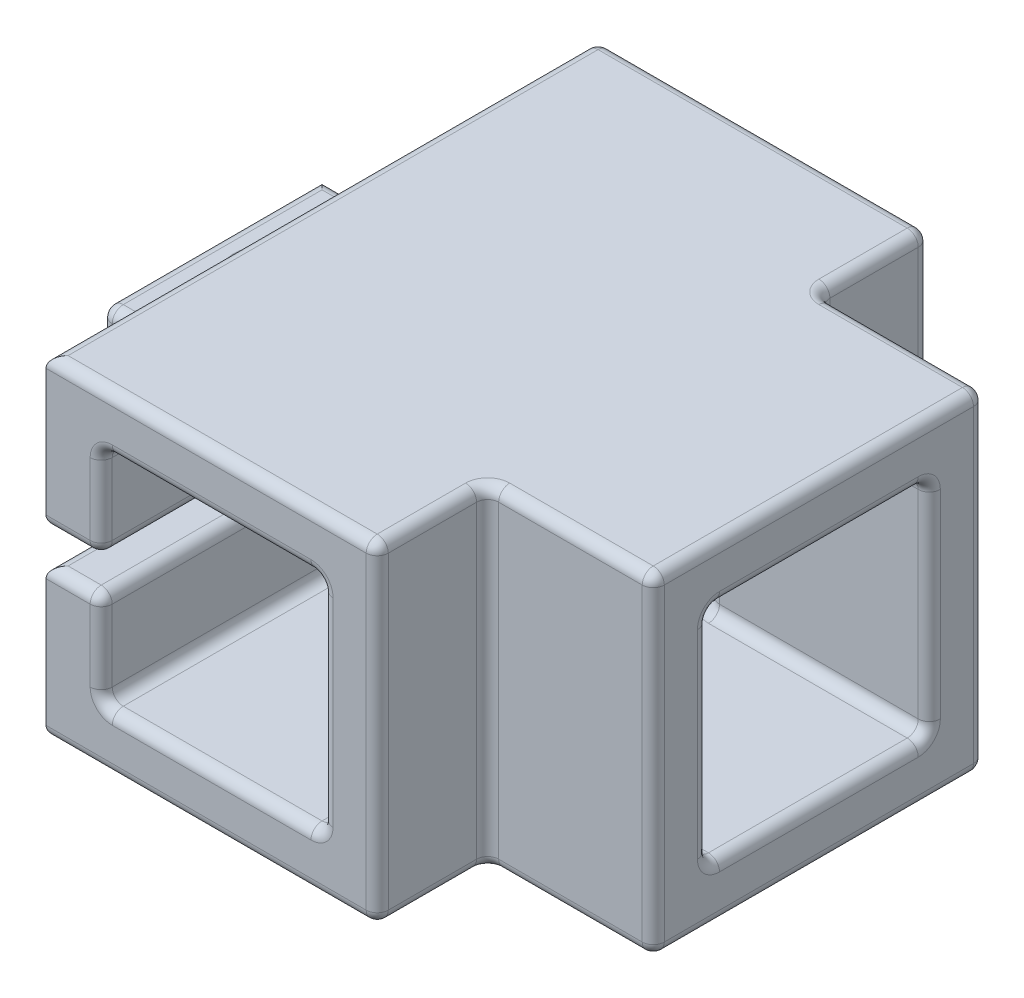
from build123d import *

# Parameters (mm, degrees)
SKETCH1_W           = 30
SKETCH1_H           = 30
SKETCH1_W_2         = 20
SKETCH1_H_2         = 20
BOSS_EXTRUDE1_DEPTH = 50
BOSS_EXTRUDE2_DEPTH = 30
SKETCH3_W           = 20
SKETCH3_H           = 20
CUT_EXTRUDE1_DEPTH  = 6
BOSS_EXTRUDE3_START = -15
SKETCH4_W           = 10
SKETCH4_H           = 5
BOSS_EXTRUDE3_DEPTH = 20
CUT_EXTRUDE2_DEPTH  = 30
SKETCH6_W           = 5
SKETCH6_H           = 3
CUT_EXTRUDE3_DEPTH  = 140
SKETCH7_W           = 30
SKETCH7_H           = 30
CUT_EXTRUDE4_DEPTH  = 15
FILLET1_R           = 1
FILLET2_R           = 1
FILLET3_R           = 1
FILLET4_R           = 1


with BuildPart() as part:
    # Sketch1 → Boss-Extrude1 (new body)
    with BuildSketch(Plane.XY):
        with Locations((4.157585004, -1.897870029)):
            Rectangle(SKETCH1_W, SKETCH1_H)
        with Locations((4.157585004, -1.897870029)):
            Rectangle(SKETCH1_W_2, SKETCH1_H_2, mode=Mode.SUBTRACT)
    extrude(amount=BOSS_EXTRUDE1_DEPTH)

    # Sketch2 → Boss-Extrude2 (add)
    with BuildSketch(Plane(origin=(19.157585004, 0, 0), x_dir=(0, 0, -1), z_dir=(1, 0, 0))):
        Polygon((-25, 13.102129971), (-10, 13.102129971), (-10, -16.897870029), (-40, -16.897870029), (-40, 13.102129971), align=None)
        Polygon((-35, 8.102129971), (-25, 8.102129971), (-15, 8.102129971), (-15, -11.897870029), (-35, -11.897870029), align=None, mode=Mode.SUBTRACT)
    extrude(amount=BOSS_EXTRUDE2_DEPTH)

    # Sketch3 → Cut-Extrude1 (cut)
    with BuildSketch(Plane(origin=(19.157585004, 0, 0), x_dir=(0, 0, -1), z_dir=(1, 0, 0))):
        with Locations((-25, -1.897870029)):
            Rectangle(SKETCH3_W, SKETCH3_H)
    extrude(amount=-CUT_EXTRUDE1_DEPTH, mode=Mode.SUBTRACT)

    # Sketch4 → Boss-Extrude3 (add)
    with BuildSketch(Plane(origin=(0, 0, 0), x_dir=(-1, 0, 0), z_dir=(0, 0, -1)).offset(BOSS_EXTRUDE3_START)):
        with Locations((15.842414996, 2.102129971)):
            Rectangle(SKETCH4_W, SKETCH4_H)
        with Locations((15.842414996, -5.897870029)):
            Rectangle(SKETCH4_W, SKETCH4_H)
    extrude(amount=-BOSS_EXTRUDE3_DEPTH)

    # Sketch5 → Cut-Extrude2 (cut)
    with BuildSketch(Plane(origin=(0, 4.602129971, 0), x_dir=(1, 0, 0), z_dir=(0, 1, 0))):
        with BuildLine():
            ThreePointArc((-13.842414996, -25), (-14.790952771, -23.298698383), (-16.736842187, -23.211145618))
            Line((-16.736842187, -23.211145618), (-14.947987805, -26.788854382))
            ThreePointArc((-14.947987805, -26.788854382), (-14.141113379, -26.051462224), (-13.842414996, -25))
        make_face()
        with BuildLine():
            Line((-14.947987805, -26.788854382), (-16.736842187, -23.211145618))
            ThreePointArc((-16.736842187, -23.211145618), (-17.631269378, -25.894427191), (-14.947987805, -26.788854382))
        make_face()
    extrude(amount=-CUT_EXTRUDE2_DEPTH, mode=Mode.SUBTRACT)

    # Sketch6 → Cut-Extrude3 (cut)
    with BuildSketch(Plane.XY.offset(50)):
        with Locations((-8.342414996, -1.897870029)):
            Rectangle(SKETCH6_W, SKETCH6_H)
    extrude(amount=-CUT_EXTRUDE3_DEPTH, mode=Mode.SUBTRACT)

    # Sketch7 → Cut-Extrude4 (cut)
    with BuildSketch(Plane(origin=(49.157585004, 0, 0), x_dir=(0, 0, -1), z_dir=(1, 0, 0))):
        with Locations((-25, -1.897870029)):
            Rectangle(SKETCH7_W, SKETCH7_H)
    extrude(amount=-CUT_EXTRUDE4_DEPTH, mode=Mode.SUBTRACT)

    # Fillet1
    fillet1_edges = [part.edges().sort_by_distance(p)[0] for p in [
        (-5.842414996, -7.647870029, 0),
        (-5.842414996, -7.647870029, 50),
        (-5.842414996, -3.397870029, 25),
        (-5.842414996, -0.397870029, 25),
        (-10.842414996, -10.147870029, 0),
        (-8.342414996, -0.397870029, 0),
        (-8.342414996, -3.397870029, 0),
        (19.157585004, -1.897870029, 50),
        (24.157585004, 8.102129971, 15),
        (24.157585004, -11.897870029, 15),
        (34.157585004, -1.897870029, 15),
        (24.157585004, -11.897870029, 35),
        (24.157585004, 8.102129971, 35),
        (26.657585004, 13.102129971, 10),
        (26.657585004, -16.897870029, 10),
        (26.657585004, -16.897870029, 40),
        (26.657585004, 13.102129971, 40),
        (34.157585004, -1.897870029, 35),
        (34.157585004, -1.897870029, 10),
        (34.157585004, -16.897870029, 25),
        (34.157585004, -1.897870029, 40),
        (34.157585004, 13.102129971, 25),
        (34.157585004, 8.102129971, 25),
        (34.157585004, -11.897870029, 25),
        (4.157585004, 8.102129971, 0),
        (14.157585004, 8.102129971, 42.5),
        (-5.842414996, 3.852129971, 0),
        (-5.842414996, 8.102129971, 25),
        (4.157585004, -11.897870029, 0),
        (-5.842414996, -11.897870029, 25),
        (14.157585004, -1.897870029, 0),
        (14.157585004, -11.897870029, 42.5),
        (4.157585004, 8.102129971, 50),
        (4.157585004, 13.102129971, 50),
        (-5.842414996, 3.852129971, 50),
        (4.157585004, -11.897870029, 50),
        (14.157585004, -1.897870029, 50),
        (19.157585004, 13.102129971, 5),
        (19.157585004, -16.897870029, 5),
        (19.157585004, -1.897870029, 40),
        (19.157585004, -1.897870029, 10),
        (4.157585004, 13.102129971, 0),
        (14.157585004, -11.897870029, 7.5),
        (19.157585004, -1.897870029, 0),
        (14.157585004, 8.102129971, 7.5),
        (14.157585004, -1.897870029, 15),
        (14.157585004, -1.897870029, 35),
        (4.157585004, -16.897870029, 0),
        (-10.842414996, 6.352129971, 0),
        (-10.842414996, 13.102129971, 25),
        (19.157585004, 13.102129971, 45),
        (19.157585004, -16.897870029, 45),
        (-10.842414996, -16.897870029, 25),
        (4.157585004, -16.897870029, 50),
    ]]
    fillet(fillet1_edges, radius=FILLET1_R)

    # Fillet2
    # the kernel refuses this fillet: 1 mm, written as the material it takes off along each edge
    with BuildSketch(Plane(origin=(-19.842414996, -7.397870029, 34), x_dir=(-1, 0, 0), z_dir=(0, 0, 1))) as fillet2_piece_1_section:
        Polygon((0, 0), (FILLET2_R, 0), (FILLET2_R, FILLET2_R), (0, FILLET2_R), align=None)
    fillet2_piece_1 = extrude(amount=FILLET2_R, mode=Mode.PRIVATE)
    fillet2_piece_1 = fillet2_piece_1 - Plane(origin=(-19.842414996, -7.397870029, 34), x_dir=(0.7071067811865475, 0.7071067811865476, 0), z_dir=(0, 0, 1)) * Sphere(FILLET2_R, mode=Mode.PRIVATE)
    add(fillet2_piece_1, mode=Mode.SUBTRACT)
    with BuildSketch(Plane(origin=(-19.842414996, -7.397870029, 16), x_dir=(0, 0, -1), z_dir=(-1, 0, 0))) as fillet2_piece_2_section:
        Polygon((0, 0), (FILLET2_R, 0), (FILLET2_R, FILLET2_R), (0, FILLET2_R), align=None)
    fillet2_piece_2 = extrude(amount=FILLET2_R, mode=Mode.PRIVATE)
    fillet2_piece_2 = fillet2_piece_2 - Plane(origin=(-19.842414996, -7.397870029, 16), x_dir=(0, 0.7071067811865475, 0.7071067811865475), z_dir=(-1, 0, 0)) * Sphere(FILLET2_R, mode=Mode.PRIVATE)
    add(fillet2_piece_2, mode=Mode.SUBTRACT)
    with BuildSketch(Plane(origin=(-20.842414996, -3.397870029, 12.5), x_dir=(1, 0, 0), z_dir=(0, 0, 1)), Plane(origin=(-20.842414996, 4.602129971, 12.5), x_dir=(1, 0, 0), z_dir=(0, 0, 1))) as fillet2_piece_3:
        with BuildLine():
            CenterArc((FILLET2_R, -FILLET2_R), FILLET2_R, 90, 90)
            Line((0, -FILLET2_R), (0, 0))
            Line((0, 0), (FILLET2_R, 0))
        make_face()
    extrude(amount=25, mode=Mode.SUBTRACT)
    with BuildSketch(Plane(origin=(-20.842414996, -7.397870029, 35), x_dir=(1, 0, 0), z_dir=(0, 1, 0))) as fillet2_piece_4:
        with BuildLine():
            CenterArc((FILLET2_R, FILLET2_R), FILLET2_R, 180, 90)
            Line((0, FILLET2_R), (0, 0))
            Line((0, 0), (FILLET2_R, 0))
        make_face()
    extrude(amount=6.5, mode=Mode.SUBTRACT)
    with BuildSketch(Plane(origin=(-20.842414996, -8.397870029, 16), x_dir=(1, 0, 0), z_dir=(0, 0, 1))) as fillet2_piece_5:
        with BuildLine():
            CenterArc((FILLET2_R, FILLET2_R), FILLET2_R, 180, 90)
            Line((0, FILLET2_R), (0, 0))
            Line((0, 0), (FILLET2_R, 0))
        make_face()
    extrude(amount=18, mode=Mode.SUBTRACT)
    with BuildSketch(Plane(origin=(-20.842414996, -7.397870029, 15), x_dir=(1, 0, 0), z_dir=(0, 1, 0))) as fillet2_piece_6:
        with BuildLine():
            CenterArc((FILLET2_R, -FILLET2_R), FILLET2_R, 90, 90)
            Line((0, -FILLET2_R), (0, 0))
            Line((0, 0), (FILLET2_R, 0))
        make_face()
    extrude(amount=6.5, mode=Mode.SUBTRACT)
    with BuildSketch(Plane(origin=(-10.842414996, -8.397870029, 15), x_dir=(0, 1, 0), z_dir=(-1, 0, 0)), Plane(origin=(-10.842414996, -8.397870029, 35), x_dir=(0, 0, -1), z_dir=(-1, 0, 0))) as fillet2_piece_7:
        with BuildLine():
            CenterArc((FILLET2_R, -FILLET2_R), FILLET2_R, 90, 90)
            Line((0, -FILLET2_R), (0, 0))
            Line((0, 0), (FILLET2_R, 0))
        make_face()
    extrude(amount=9, mode=Mode.SUBTRACT)
    with BuildSketch(Plane(origin=(-23.342414996, 4.602129971, 35), x_dir=(0, -1, 0), z_dir=(1, 0, 0)), Plane(origin=(-23.342414996, 4.602129971, 15), x_dir=(0, 0, 1), z_dir=(1, 0, 0))) as fillet2_piece_8:
        with BuildLine():
            CenterArc((FILLET2_R, FILLET2_R), FILLET2_R, 180, 90)
            Line((0, FILLET2_R), (0, 0))
            Line((0, 0), (FILLET2_R, 0))
        make_face()
    extrude(amount=12.5, mode=Mode.SUBTRACT)
    with BuildSketch(Plane(origin=(-15.842414996, 4.602129971, 25), x_dir=(0.4472135954999714, 0, 0.8944271909999091), z_dir=(0.8944271909999091, 0, -0.4472135954999714))) as fillet2_piece_9:
        with BuildLine():
            CenterArc((2 + FILLET2_R, FILLET2_R), FILLET2_R, 180, 90)
            Line((2, FILLET2_R), (2, 0))
            Line((2, 0), (2 + FILLET2_R, 0))
        make_face()
    revolve(axis=Axis((-15.842414996, 4.602129971, 25), (0, -1, 0)), mode=Mode.SUBTRACT)
    # the kernel refuses this fillet: 1 mm, written as the material it adds along each edge
    with BuildSketch(Plane(origin=(-10.842414996, -3.397870029, 35), x_dir=(0, 0, 1), z_dir=(0, -1, 0)), Plane(origin=(-10.842414996, 3.602129971, 35), x_dir=(0, 0, 1), z_dir=(0, -1, 0))) as fillet2_2_piece_1:
        with BuildLine():
            CenterArc((FILLET2_R, FILLET2_R), FILLET2_R, 180, 90)
            Line((0, FILLET2_R), (0, 0))
            Line((0, 0), (FILLET2_R, 0))
        make_face()
    extrude(amount=4)
    with BuildSketch(Plane(origin=(-10.842414996, -8.397870029, 16), x_dir=(0, -1, 0), z_dir=(0, 0, 1))) as fillet2_2_piece_2:
        with BuildLine():
            CenterArc((FILLET2_R, -FILLET2_R), FILLET2_R, 90, 90)
            Line((0, -FILLET2_R), (0, 0))
            Line((0, 0), (FILLET2_R, 0))
        make_face()
    extrude(amount=18)
    with BuildSketch(Plane(origin=(-10.842414996, 3.602129971, 15), x_dir=(0, 0, -1), z_dir=(0, -1, 0)), Plane(origin=(-10.842414996, -3.397870029, 15), x_dir=(0, 0, -1), z_dir=(0, -1, 0))) as fillet2_2_piece_3:
        with BuildLine():
            CenterArc((FILLET2_R, -FILLET2_R), FILLET2_R, 90, 90)
            Line((0, -FILLET2_R), (0, 0))
            Line((0, 0), (FILLET2_R, 0))
        make_face()
    extrude(amount=4)
    with BuildSketch(Plane(origin=(-10.842414996, 4.602129971, 16), x_dir=(0, 1, 0), z_dir=(0, 0, 1))) as fillet2_2_piece_4:
        with BuildLine():
            CenterArc((FILLET2_R, FILLET2_R), FILLET2_R, 180, 90)
            Line((0, FILLET2_R), (0, 0))
            Line((0, 0), (FILLET2_R, 0))
        make_face()
    extrude(amount=18)
    with BuildSketch(Plane(origin=(-10.842414996, 3.602129971, 16), x_dir=(0, 1, 0), z_dir=(0, 0, 1))) as fillet2_2_piece_5:
        with BuildLine():
            CenterArc((1 + FILLET2_R, FILLET2_R), FILLET2_R, 180, 90)
            Line((1, FILLET2_R), (1, 0))
            Line((1, 0), (1 + FILLET2_R, 0))
        make_face()
    revolve(axis=Axis((-10.842414996, 3.602129971, 16), (-1, 0, 0)), revolution_arc=90)
    with BuildSketch(Plane(origin=(-10.842414996, 3.602129971, 34), x_dir=(0, 0, 1), z_dir=(0, -1, 0))) as fillet2_2_piece_6:
        with BuildLine():
            CenterArc((1 + FILLET2_R, FILLET2_R), FILLET2_R, 180, 90)
            Line((1, FILLET2_R), (1, 0))
            Line((1, 0), (1 + FILLET2_R, 0))
        make_face()
    revolve(axis=Axis((-10.842414996, 3.602129971, 34), (-1, 0, 0)), revolution_arc=90)
    with BuildSketch(Plane(origin=(-10.842414996, -7.397870029, 16), x_dir=(0, 0, -1), z_dir=(0, 1, 0))) as fillet2_2_piece_7:
        with BuildLine():
            CenterArc((1 + FILLET2_R, FILLET2_R), FILLET2_R, 180, 90)
            Line((1, FILLET2_R), (1, 0))
            Line((1, 0), (1 + FILLET2_R, 0))
        make_face()
    revolve(axis=Axis((-10.842414996, -7.397870029, 16), (-1, 0, 0)), revolution_arc=90)
    with BuildSketch(Plane(origin=(-10.842414996, -7.397870029, 34), x_dir=(0, -1, 0), z_dir=(0, 0, -1))) as fillet2_2_piece_8:
        with BuildLine():
            CenterArc((1 + FILLET2_R, FILLET2_R), FILLET2_R, 180, 90)
            Line((1, FILLET2_R), (1, 0))
            Line((1, 0), (1 + FILLET2_R, 0))
        make_face()
    revolve(axis=Axis((-10.842414996, -7.397870029, 34), (-1, 0, 0)), revolution_arc=90)
    # the kernel refuses this fillet: 1 mm, written as the material it takes off along each edge
    with BuildSketch(Plane(origin=(-9.842414996, -4.397870029, 1), x_dir=(0, 1, 0), z_dir=(-1, 0, 0))) as fillet2_3_piece_1_section:
        Polygon((0, 0), (FILLET2_R, 0), (FILLET2_R, FILLET2_R), (0, FILLET2_R), align=None)
    fillet2_3_piece_1 = extrude(amount=FILLET2_R, mode=Mode.PRIVATE)
    fillet2_3_piece_1 = fillet2_3_piece_1 - Plane(origin=(-9.842414996, -4.397870029, 1), x_dir=(0, -0.7071067811865475, 0.7071067811865475), z_dir=(-1, 0, 0)) * Sphere(FILLET2_R, mode=Mode.PRIVATE)
    add(fillet2_3_piece_1, mode=Mode.SUBTRACT)
    with BuildSketch(Plane(origin=(-19.842414996, -4.397870029, 16), x_dir=(0, 0, -1), z_dir=(0, 1, 0))) as fillet2_3_piece_2_section:
        Polygon((0, 0), (FILLET2_R, 0), (FILLET2_R, FILLET2_R), (0, FILLET2_R), align=None)
    fillet2_3_piece_2 = extrude(amount=FILLET2_R, mode=Mode.PRIVATE)
    fillet2_3_piece_2 = fillet2_3_piece_2 - Plane(origin=(-19.842414996, -4.397870029, 16), x_dir=(0.7071067811865475, 0, 0.7071067811865475), z_dir=(0, 1, 0)) * Sphere(FILLET2_R, mode=Mode.PRIVATE)
    add(fillet2_3_piece_2, mode=Mode.SUBTRACT)
    with BuildSketch(Plane(origin=(-10.842414996, -3.397870029, 14), x_dir=(0, -1, 0), z_dir=(0, 0, -1))) as fillet2_3_piece_3:
        with BuildLine():
            CenterArc((FILLET2_R, -FILLET2_R), FILLET2_R, 90, 90)
            Line((0, -FILLET2_R), (0, 0))
            Line((0, 0), (FILLET2_R, 0))
        make_face()
    extrude(amount=13, mode=Mode.SUBTRACT)
    with BuildSketch(Plane(origin=(-19.842414996, -3.397870029, 15), x_dir=(0, 0, 1), z_dir=(1, 0, 0))) as fillet2_3_piece_4:
        with BuildLine():
            CenterArc((FILLET2_R, FILLET2_R), FILLET2_R, 180, 90)
            Line((0, FILLET2_R), (0, 0))
            Line((0, 0), (FILLET2_R, 0))
        make_face()
    extrude(amount=8, mode=Mode.SUBTRACT)
    with BuildSketch(Plane(origin=(-11.842414996, -3.397870029, 14), x_dir=(1, 0, 0), z_dir=(0, 0, -1))) as fillet2_3_piece_5:
        with BuildLine():
            CenterArc((1 + FILLET2_R, FILLET2_R), FILLET2_R, 180, 90)
            Line((1, FILLET2_R), (1, 0))
            Line((1, 0), (1 + FILLET2_R, 0))
        make_face()
    revolve(axis=Axis((-11.842414996, -3.397870029, 14), (0, -1, 0)), revolution_arc=90, mode=Mode.SUBTRACT)

    # Fillet3
    # the kernel refuses this fillet: 1 mm, written as the material it takes off along each edge
    with BuildSketch(Plane(origin=(-9.842414996, 0.602129971, 1), x_dir=(0, -1, 0), z_dir=(-1, 0, 0))) as fillet3_piece_1_section:
        Polygon((0, 0), (FILLET3_R, 0), (FILLET3_R, -FILLET3_R), (0, -FILLET3_R), align=None)
    fillet3_piece_1 = extrude(amount=FILLET3_R, mode=Mode.PRIVATE)
    fillet3_piece_1 = fillet3_piece_1 - Plane(origin=(-9.842414996, 0.602129971, 1), x_dir=(0, 0.7071067811865475, 0.7071067811865475), z_dir=(-1, 0, 0)) * Sphere(FILLET3_R, mode=Mode.PRIVATE)
    add(fillet3_piece_1, mode=Mode.SUBTRACT)
    with BuildSketch(Plane(origin=(-6.842414996, 0.602129971, 49), x_dir=(0, -1, 0), z_dir=(0, 0, 1))) as fillet3_piece_2_section:
        Polygon((0, 0), (FILLET3_R, 0), (FILLET3_R, FILLET3_R), (0, FILLET3_R), align=None)
    fillet3_piece_2 = extrude(amount=FILLET3_R, mode=Mode.PRIVATE)
    fillet3_piece_2 = fillet3_piece_2 - Plane(origin=(-6.842414996, 0.602129971, 49), x_dir=(-0.7071067811865475, 0.7071067811865475, 0), z_dir=(0, 0, 1)) * Sphere(FILLET3_R, mode=Mode.PRIVATE)
    add(fillet3_piece_2, mode=Mode.SUBTRACT)
    with BuildSketch(Plane(origin=(-19.842414996, 3.602129971, 34), x_dir=(0, 0, 1), z_dir=(-1, 0, 0))) as fillet3_piece_3_section:
        Polygon((0, 0), (FILLET3_R, 0), (FILLET3_R, FILLET3_R), (0, FILLET3_R), align=None)
    fillet3_piece_3 = extrude(amount=FILLET3_R, mode=Mode.PRIVATE)
    fillet3_piece_3 = fillet3_piece_3 - Plane(origin=(-19.842414996, 3.602129971, 34), x_dir=(0, -0.7071067811865475, -0.7071067811865475), z_dir=(-1, 0, 0)) * Sphere(FILLET3_R, mode=Mode.PRIVATE)
    add(fillet3_piece_3, mode=Mode.SUBTRACT)
    with BuildSketch(Plane(origin=(-19.842414996, 0.602129971, 34), x_dir=(0, -1, 0), z_dir=(-1, 0, 0))) as fillet3_piece_4_section:
        Polygon((0, 0), (FILLET3_R, 0), (FILLET3_R, FILLET3_R), (0, FILLET3_R), align=None)
    fillet3_piece_4 = extrude(amount=FILLET3_R, mode=Mode.PRIVATE)
    fillet3_piece_4 = fillet3_piece_4 - Plane(origin=(-19.842414996, 0.602129971, 34), x_dir=(0, 0.7071067811865475, -0.7071067811865475), z_dir=(-1, 0, 0)) * Sphere(FILLET3_R, mode=Mode.PRIVATE)
    add(fillet3_piece_4, mode=Mode.SUBTRACT)
    with BuildSketch(Plane(origin=(-15.842414996, -0.397870029, 25), x_dir=(0.4472135954999743, 0, 0.8944271909999078), z_dir=(-0.8944271909999078, 0, 0.4472135954999743))) as fillet3_piece_5:
        with BuildLine():
            CenterArc((2 + FILLET3_R, FILLET3_R), FILLET3_R, 180, 90)
            Line((2, FILLET3_R), (2, 0))
            Line((2, 0), (2 + FILLET3_R, 0))
        make_face()
    revolve(axis=Axis((-15.842414996, -0.397870029, 25), (0, 1, 0)), mode=Mode.SUBTRACT)
    with BuildSketch(Plane(origin=(-13.342414996, -0.397870029, 50), x_dir=(0, 1, 0), z_dir=(1, 0, 0))) as fillet3_piece_6:
        with BuildLine():
            CenterArc((FILLET3_R, -FILLET3_R), FILLET3_R, 90, 90)
            Line((0, -FILLET3_R), (0, 0))
            Line((0, 0), (FILLET3_R, 0))
        make_face()
    extrude(amount=6.5, mode=Mode.SUBTRACT)
    with BuildSketch(Plane(origin=(-10.842414996, -0.397870029, 14), x_dir=(0, 1, 0), z_dir=(0, 0, -1))) as fillet3_piece_7:
        with BuildLine():
            CenterArc((FILLET3_R, FILLET3_R), FILLET3_R, 180, 90)
            Line((0, FILLET3_R), (0, 0))
            Line((0, 0), (FILLET3_R, 0))
        make_face()
    extrude(amount=13, mode=Mode.SUBTRACT)
    with BuildSketch(Plane(origin=(-11.842414996, -0.397870029, 35), x_dir=(0, 0, -1), z_dir=(-1, 0, 0))) as fillet3_piece_8:
        with BuildLine():
            CenterArc((FILLET3_R, -FILLET3_R), FILLET3_R, 90, 90)
            Line((0, -FILLET3_R), (0, 0))
            Line((0, 0), (FILLET3_R, 0))
        make_face()
    extrude(amount=8, mode=Mode.SUBTRACT)
    with BuildSketch(Plane(origin=(-10.842414996, -0.397870029, 52.5), x_dir=(0, 1, 0), z_dir=(0, 0, -1))) as fillet3_piece_9:
        with BuildLine():
            CenterArc((FILLET3_R, FILLET3_R), FILLET3_R, 180, 90)
            Line((0, FILLET3_R), (0, 0))
            Line((0, 0), (FILLET3_R, 0))
        make_face()
    extrude(amount=16.5, mode=Mode.SUBTRACT)
    with BuildSketch(Plane(origin=(-11.842414996, -0.397870029, 15), x_dir=(0, 0, 1), z_dir=(-1, 0, 0))) as fillet3_piece_10:
        with BuildLine():
            CenterArc((FILLET3_R, FILLET3_R), FILLET3_R, 180, 90)
            Line((0, FILLET3_R), (0, 0))
            Line((0, 0), (FILLET3_R, 0))
        make_face()
    extrude(amount=11.5, mode=Mode.SUBTRACT)
    with BuildSketch(Plane(origin=(-11.842414996, -0.397870029, 36), x_dir=(0, 0, -1), z_dir=(-1, 0, 0))) as fillet3_piece_11:
        with BuildLine():
            CenterArc((1 + FILLET3_R, -FILLET3_R), FILLET3_R, 90, 90)
            Line((1, -FILLET3_R), (1, 0))
            Line((1, 0), (1 + FILLET3_R, 0))
        make_face()
    revolve(axis=Axis((-11.842414996, -0.397870029, 36), (0, -1, 0)), revolution_arc=90, mode=Mode.SUBTRACT)
    with BuildSketch(Plane(origin=(-11.842414996, -0.397870029, 14), x_dir=(1, 0, 0), z_dir=(0, 0, -1))) as fillet3_piece_12:
        with BuildLine():
            CenterArc((1 + FILLET3_R, -FILLET3_R), FILLET3_R, 90, 90)
            Line((1, -FILLET3_R), (1, 0))
            Line((1, 0), (1 + FILLET3_R, 0))
        make_face()
    revolve(axis=Axis((-11.842414996, -0.397870029, 14), (0, -1, 0)), revolution_arc=90, mode=Mode.SUBTRACT)
    with BuildSketch(Plane(origin=(-20.842414996, 0.602129971, 35), x_dir=(0, 0, -1), z_dir=(0, 1, 0))) as fillet3_piece_13:
        with BuildLine():
            CenterArc((FILLET3_R, -FILLET3_R), FILLET3_R, 90, 90)
            Line((0, -FILLET3_R), (0, 0))
            Line((0, 0), (FILLET3_R, 0))
        make_face()
    extrude(amount=3, mode=Mode.SUBTRACT)
    with BuildSketch(Plane(origin=(-20.842414996, -0.397870029, 12.5), x_dir=(1, 0, 0), z_dir=(0, 0, 1))) as fillet3_piece_14:
        with BuildLine():
            CenterArc((FILLET3_R, FILLET3_R), FILLET3_R, 180, 90)
            Line((0, FILLET3_R), (0, 0))
            Line((0, 0), (FILLET3_R, 0))
        make_face()
    extrude(amount=21.5, mode=Mode.SUBTRACT)

    # Fillet4
    # the kernel refuses this fillet: 1 mm, written as the material it takes off along each edge
    with BuildSketch(Plane(origin=(-6.842414996, -4.397870029, 49), x_dir=(0, 0, 1), z_dir=(0, 1, 0))) as fillet4_piece_1_section:
        Polygon((0, 0), (FILLET4_R, 0), (FILLET4_R, FILLET4_R), (0, FILLET4_R), align=None)
    fillet4_piece_1 = extrude(amount=FILLET4_R, mode=Mode.PRIVATE)
    fillet4_piece_1 = fillet4_piece_1 - Plane(origin=(-6.842414996, -4.397870029, 49), x_dir=(-0.7071067811865475, 0, -0.7071067811865475), z_dir=(0, 1, 0)) * Sphere(FILLET4_R, mode=Mode.PRIVATE)
    add(fillet4_piece_1, mode=Mode.SUBTRACT)
    with BuildSketch(Plane(origin=(-19.842414996, -4.397870029, 34), x_dir=(0, 1, 0), z_dir=(0, 0, 1))) as fillet4_piece_2_section:
        Polygon((0, 0), (FILLET4_R, 0), (FILLET4_R, FILLET4_R), (0, FILLET4_R), align=None)
    fillet4_piece_2 = extrude(amount=FILLET4_R, mode=Mode.PRIVATE)
    fillet4_piece_2 = fillet4_piece_2 - Plane(origin=(-19.842414996, -4.397870029, 34), x_dir=(0.7071067811865475, -0.7071067811865475, 0), z_dir=(0, 0, 1)) * Sphere(FILLET4_R, mode=Mode.PRIVATE)
    add(fillet4_piece_2, mode=Mode.SUBTRACT)
    with BuildSketch(Plane(origin=(-15.842414996, -3.397870029, 25), x_dir=(0.4472135954999743, 0, 0.8944271909999078), z_dir=(-0.8944271909999078, 0, 0.4472135954999743))) as fillet4_piece_3:
        with BuildLine():
            CenterArc((2 + FILLET4_R, -FILLET4_R), FILLET4_R, 90, 90)
            Line((2, -FILLET4_R), (2, 0))
            Line((2, 0), (2 + FILLET4_R, 0))
        make_face()
    revolve(axis=Axis((-15.842414996, -3.397870029, 25), (0, 1, 0)), mode=Mode.SUBTRACT)
    with BuildSketch(Plane(origin=(-15.842414996, -8.397870029, 25), x_dir=(0.4472135954999743, 0, 0.8944271909999078), z_dir=(-0.8944271909999078, 0, 0.4472135954999743))) as fillet4_piece_4:
        with BuildLine():
            CenterArc((2 + FILLET4_R, FILLET4_R), FILLET4_R, 180, 90)
            Line((2, FILLET4_R), (2, 0))
            Line((2, 0), (2 + FILLET4_R, 0))
        make_face()
    revolve(axis=Axis((-15.842414996, -8.397870029, 25), (0, 1, 0)), mode=Mode.SUBTRACT)
    with BuildSketch(Plane(origin=(-6.842414996, -3.397870029, 50), x_dir=(0, 0, -1), z_dir=(-1, 0, 0))) as fillet4_piece_5:
        with BuildLine():
            CenterArc((FILLET4_R, FILLET4_R), FILLET4_R, 180, 90)
            Line((0, FILLET4_R), (0, 0))
            Line((0, 0), (FILLET4_R, 0))
        make_face()
    extrude(amount=6.5, mode=Mode.SUBTRACT)
    with BuildSketch(Plane(origin=(-19.842414996, -3.397870029, 35), x_dir=(0, -1, 0), z_dir=(1, 0, 0))) as fillet4_piece_6:
        with BuildLine():
            CenterArc((FILLET4_R, FILLET4_R), FILLET4_R, 180, 90)
            Line((0, FILLET4_R), (0, 0))
            Line((0, 0), (FILLET4_R, 0))
        make_face()
    extrude(amount=8, mode=Mode.SUBTRACT)
    with BuildSketch(Plane(origin=(-10.842414996, -3.397870029, 52.5), x_dir=(0, -1, 0), z_dir=(0, 0, -1))) as fillet4_piece_7:
        with BuildLine():
            CenterArc((FILLET4_R, -FILLET4_R), FILLET4_R, 90, 90)
            Line((0, -FILLET4_R), (0, 0))
            Line((0, 0), (FILLET4_R, 0))
        make_face()
    extrude(amount=16.5, mode=Mode.SUBTRACT)
    with BuildSketch(Plane(origin=(-11.842414996, -3.397870029, 36), x_dir=(0, 0, -1), z_dir=(-1, 0, 0))) as fillet4_piece_8:
        with BuildLine():
            CenterArc((1 + FILLET4_R, FILLET4_R), FILLET4_R, 180, 90)
            Line((1 + FILLET4_R, 0), (1, 0))
            Line((1, 0), (1, FILLET4_R))
        make_face()
    revolve(axis=Axis((-11.842414996, -3.397870029, 36), (0, -1, 0)), revolution_arc=90, mode=Mode.SUBTRACT)


solid = part.part
